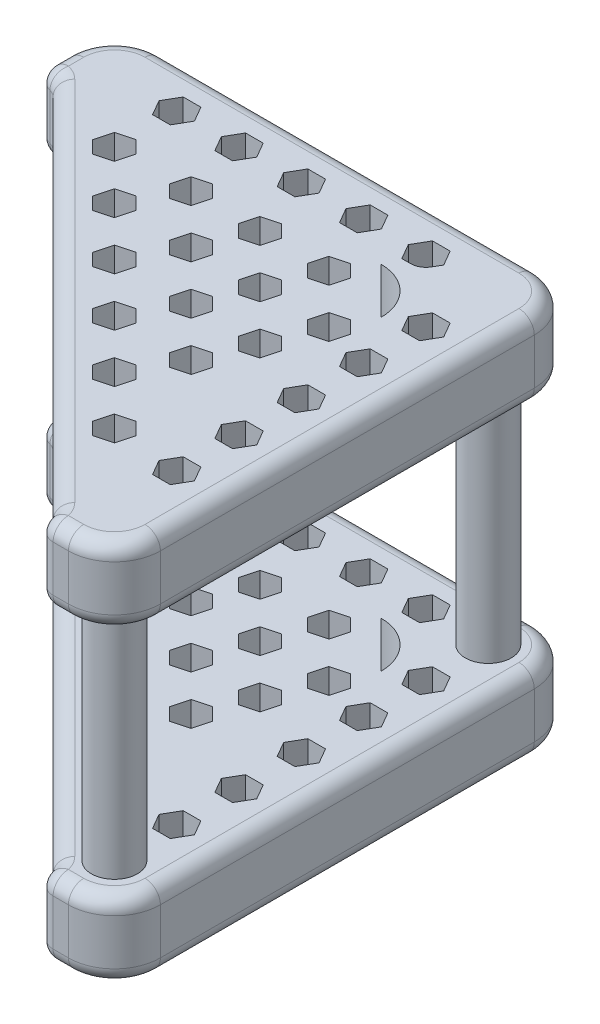
from build123d import *

# Parameters (mm, degrees)
SKETCH1_R           = 1.5
BOSS_EXTRUDE1_DEPTH = 5
SKETCH1_2_R         = 1.5
BOSS_EXTRUDE2_DEPTH = 25
BOSS_EXTRUDE3_START = -5
SKETCH2_R           = 1.5
BOSS_EXTRUDE3_DEPTH = 5
FILLET1_R           = 1


with BuildPart() as part:
    # Sketch1 → Boss-Extrude1 (new body)
    with BuildSketch(Plane(origin=(0, 0, 0), x_dir=(1, 0, 0), z_dir=(0, 1, 0))):
        with BuildLine():
            Line((-9.7, 17.7), (14.7, 17.7))
            ThreePointArc((14.7, 17.7), (16.821320344, 16.821320344), (17.7, 14.7))
            Line((17.7, 14.7), (17.7, -9.7))
            ThreePointArc((17.7, -9.7), (16.821320344, -11.821320344), (14.7, -12.7))
            Line((14.7, -12.7), (13.7, -12.7))
            ThreePointArc((13.7, -12.7), (13.08159356, -12.485858432), (12.72804017, -11.935146951))
            ThreePointArc((12.72804017, -11.935146951), (12.628148394, -11.68090928), (12.463187121, -11.463187121))
            Line((12.463187121, -11.463187121), (-11.463187121, 12.463187121))
            ThreePointArc((-11.463187121, 12.463187121), (-11.68090928, 12.628148394), (-11.935146951, 12.72804017))
            ThreePointArc((-11.935146951, 12.72804017), (-12.485858432, 13.08159356), (-12.7, 13.7))
            Line((-12.7, 13.7), (-12.7, 14.7))
            ThreePointArc((-12.7, 14.7), (-11.821320344, 16.821320344), (-9.7, 17.7))
        make_face()
        with Locations((-9.7, 14.7)):
            Circle(SKETCH1_R, mode=Mode.SUBTRACT)
        with Locations((14.7, -9.7)):
            Circle(SKETCH1_R, mode=Mode.SUBTRACT)
        with Locations((14.7, 14.7)):
            Circle(SKETCH1_R, mode=Mode.SUBTRACT)
        Polygon((-4.478632795, 14.7), (-5.055983064, 15.7), (-6.210683603, 15.7), (-6.788033872, 14.7), (-6.210683603, 13.7), (-5.055983064, 13.7), align=None, mode=Mode.SUBTRACT)
        Polygon((-0.411966128, 14.7), (-0.989316397, 15.7), (-2.144016936, 15.7), (-2.721367205, 14.7), (-2.144016936, 13.7), (-0.989316397, 13.7), align=None, mode=Mode.SUBTRACT)
        Polygon((3.654700538, 14.7), (3.077350269, 15.7), (1.922649731, 15.7), (1.345299462, 14.7), (1.922649731, 13.7), (3.077350269, 13.7), align=None, mode=Mode.SUBTRACT)
        Polygon((7.721367205, 14.7), (7.144016936, 15.7), (5.989316397, 15.7), (5.411966128, 14.7), (5.989316397, 13.7), (7.144016936, 13.7), align=None, mode=Mode.SUBTRACT)
        Polygon((11.788033872, 14.7), (11.210683603, 15.7), (10.055983064, 15.7), (9.478632795, 14.7), (10.055983064, 13.7), (11.210683603, 13.7), align=None, mode=Mode.SUBTRACT)
        Polygon((15.854700538, 10.633333333), (15.277350269, 11.633333333), (14.122649731, 11.633333333), (13.545299462, 10.633333333), (14.122649731, 9.633333333), (15.277350269, 9.633333333), align=None, mode=Mode.SUBTRACT)
        Polygon((15.854700538, 6.566666667), (15.277350269, 7.566666667), (14.122649731, 7.566666667), (13.545299462, 6.566666667), (14.122649731, 5.566666667), (15.277350269, 5.566666667), align=None, mode=Mode.SUBTRACT)
        Polygon((15.854700538, 2.5), (15.277350269, 3.5), (14.122649731, 3.5), (13.545299462, 2.5), (14.122649731, 1.5), (15.277350269, 1.5), align=None, mode=Mode.SUBTRACT)
        Polygon((15.854700538, -1.566666667), (15.277350269, -0.566666667), (14.122649731, -0.566666667), (13.545299462, -1.566666667), (14.122649731, -2.566666667), (15.277350269, -2.566666667), align=None, mode=Mode.SUBTRACT)
        Polygon((15.854700538, -5.633333333), (15.277350269, -4.633333333), (14.122649731, -4.633333333), (13.545299462, -5.633333333), (14.122649731, -6.633333333), (15.277350269, -6.633333333), align=None, mode=Mode.SUBTRACT)
        with BuildLine():
            Line((9.7, 12.7), (12.7, 9.7))
            ThreePointArc((12.7, 9.7), (11.821320344, 11.821320344), (9.7, 12.7))
        make_face(mode=Mode.SUBTRACT)
        Polygon((-1.634856237, 6.634856237), (-1.335997746, 7.750211309), (-2.152494327, 8.56670789), (-3.267849399, 8.267849399), (-3.56670789, 7.152494327), (-2.750211309, 6.335997746), align=None, mode=Mode.SUBTRACT)
        Polygon((-4.816836752, 9.816836752), (-4.517978262, 10.932191824), (-5.334474843, 11.748688405), (-6.449829914, 11.449829914), (-6.748688405, 10.334474843), (-5.932191824, 9.517978262), align=None, mode=Mode.SUBTRACT)
        Polygon((1.547124278, 3.452875722), (1.845982769, 4.568230793), (1.029486188, 5.384727374), (-0.085868884, 5.085868884), (-0.384727374, 3.970513812), (0.431769207, 3.154017231), align=None, mode=Mode.SUBTRACT)
        Polygon((4.729104794, 0.270895206), (5.027963284, 1.386250278), (4.211466703, 2.202746859), (3.096111632, 1.903888368), (2.797253141, 0.788533297), (3.613749722, -0.027963284), align=None, mode=Mode.SUBTRACT)
        Polygon((7.911085309, -2.911085309), (8.2099438, -1.795730237), (7.393447219, -0.979233656), (6.278092147, -1.278092147), (5.979233656, -2.393447219), (6.795730237, -3.2099438), align=None, mode=Mode.SUBTRACT)
        Polygon((11.093065824, -6.093065824), (11.391924315, -4.977710753), (10.575427734, -4.161214172), (9.460072662, -4.460072662), (9.161214172, -5.575427734), (9.977710753, -6.391924315), align=None, mode=Mode.SUBTRACT)
        Polygon((0.183163248, 9.816836752), (0.482021738, 10.932191824), (-0.334474843, 11.748688405), (-1.449829914, 11.449829914), (-1.748688405, 10.334474843), (-0.932191824, 9.517978262), align=None, mode=Mode.SUBTRACT)
        Polygon((3.365143763, 6.634856237), (3.664002254, 7.750211309), (2.847505673, 8.56670789), (1.732150601, 8.267849399), (1.43329211, 7.152494327), (2.249788691, 6.335997746), align=None, mode=Mode.SUBTRACT)
        Polygon((6.547124278, 3.452875722), (6.845982769, 4.568230793), (6.029486188, 5.384727374), (4.914131116, 5.085868884), (4.615272626, 3.970513812), (5.431769207, 3.154017231), align=None, mode=Mode.SUBTRACT)
        Polygon((9.729104794, 0.270895206), (10.027963284, 1.386250278), (9.211466703, 2.202746859), (8.096111632, 1.903888368), (7.797253141, 0.788533297), (8.613749722, -0.027963284), align=None, mode=Mode.SUBTRACT)
        Polygon((4.683163248, 9.816836752), (4.982021738, 10.932191824), (4.165525157, 11.748688405), (3.050170086, 11.449829914), (2.751311595, 10.334474843), (3.567808176, 9.517978262), align=None, mode=Mode.SUBTRACT)
        Polygon((7.865143763, 6.634856237), (8.164002254, 7.750211309), (7.347505673, 8.56670789), (6.232150601, 8.267849399), (5.93329211, 7.152494327), (6.749788691, 6.335997746), align=None, mode=Mode.SUBTRACT)
        Polygon((11.047124278, 3.452875722), (11.345982769, 4.568230793), (10.529486188, 5.384727374), (9.414131116, 5.085868884), (9.115272626, 3.970513812), (9.931769207, 3.154017231), align=None, mode=Mode.SUBTRACT)
        Polygon((9.183163248, 9.816836752), (9.482021738, 10.932191824), (8.665525157, 11.748688405), (7.550170086, 11.449829914), (7.251311595, 10.334474843), (8.067808176, 9.517978262), align=None, mode=Mode.SUBTRACT)
        Polygon((12.365143763, 6.634856237), (12.664002254, 7.750211309), (11.847505673, 8.56670789), (10.732150601, 8.267849399), (10.43329211, 7.152494327), (11.249788691, 6.335997746), align=None, mode=Mode.SUBTRACT)
    extrude(amount=BOSS_EXTRUDE1_DEPTH)

    # Sketch1<2> → Boss-Extrude2 (add)
    with BuildSketch(Plane(origin=(0, 0, 0), x_dir=(1, 0, 0), z_dir=(0, 1, 0))):
        with Locations((-9.7, 14.7)):
            Circle(SKETCH1_2_R)
        with Locations((14.7, -9.7)):
            Circle(SKETCH1_2_R)
        with Locations((14.7, 14.7)):
            Circle(SKETCH1_2_R)
    extrude(amount=BOSS_EXTRUDE2_DEPTH)

    # Sketch2 → Boss-Extrude3 (add)
    with BuildSketch(Plane(origin=(0, 25, 0), x_dir=(1, 0, 0), z_dir=(0, 1, 0)).offset(BOSS_EXTRUDE3_START)):
        with BuildLine():
            Line((-9.7, 17.7), (14.7, 17.7))
            ThreePointArc((14.7, 17.7), (16.821320344, 16.821320344), (17.7, 14.7))
            Line((17.7, 14.7), (17.7, -9.7))
            ThreePointArc((17.7, -9.7), (16.821320344, -11.821320344), (14.7, -12.7))
            Line((14.7, -12.7), (13.7, -12.7))
            ThreePointArc((13.7, -12.7), (13.08159356, -12.485858432), (12.72804017, -11.935146951))
            ThreePointArc((12.72804017, -11.935146951), (12.628148394, -11.68090928), (12.463187121, -11.463187121))
            Line((12.463187121, -11.463187121), (-11.463187121, 12.463187121))
            ThreePointArc((-11.463187121, 12.463187121), (-11.68090928, 12.628148394), (-11.935146951, 12.72804017))
            ThreePointArc((-11.935146951, 12.72804017), (-12.485858432, 13.08159356), (-12.7, 13.7))
            Line((-12.7, 13.7), (-12.7, 14.7))
            ThreePointArc((-12.7, 14.7), (-11.821320344, 16.821320344), (-9.7, 17.7))
        make_face()
        with Locations((-9.7, 14.7)):
            Circle(SKETCH2_R, mode=Mode.SUBTRACT)
        with Locations((14.7, -9.7)):
            Circle(SKETCH2_R, mode=Mode.SUBTRACT)
        with Locations((14.7, 14.7)):
            Circle(SKETCH2_R, mode=Mode.SUBTRACT)
        Polygon((-4.478632795, 14.7), (-5.055983064, 15.7), (-6.210683603, 15.7), (-6.788033872, 14.7), (-6.210683603, 13.7), (-5.055983064, 13.7), align=None, mode=Mode.SUBTRACT)
        Polygon((-0.411966128, 14.7), (-0.989316397, 15.7), (-2.144016936, 15.7), (-2.721367205, 14.7), (-2.144016936, 13.7), (-0.989316397, 13.7), align=None, mode=Mode.SUBTRACT)
        Polygon((3.654700538, 14.7), (3.077350269, 15.7), (1.922649731, 15.7), (1.345299462, 14.7), (1.922649731, 13.7), (3.077350269, 13.7), align=None, mode=Mode.SUBTRACT)
        Polygon((7.721367205, 14.7), (7.144016936, 15.7), (5.989316397, 15.7), (5.411966128, 14.7), (5.989316397, 13.7), (7.144016936, 13.7), align=None, mode=Mode.SUBTRACT)
        Polygon((11.788033872, 14.7), (11.210683603, 15.7), (10.055983064, 15.7), (9.478632795, 14.7), (10.055983064, 13.7), (11.210683603, 13.7), align=None, mode=Mode.SUBTRACT)
        Polygon((15.854700538, 10.633333333), (15.277350269, 11.633333333), (14.122649731, 11.633333333), (13.545299462, 10.633333333), (14.122649731, 9.633333333), (15.277350269, 9.633333333), align=None, mode=Mode.SUBTRACT)
        Polygon((15.854700538, 6.566666667), (15.277350269, 7.566666667), (14.122649731, 7.566666667), (13.545299462, 6.566666667), (14.122649731, 5.566666667), (15.277350269, 5.566666667), align=None, mode=Mode.SUBTRACT)
        Polygon((15.854700538, 2.5), (15.277350269, 3.5), (14.122649731, 3.5), (13.545299462, 2.5), (14.122649731, 1.5), (15.277350269, 1.5), align=None, mode=Mode.SUBTRACT)
        Polygon((15.854700538, -1.566666667), (15.277350269, -0.566666667), (14.122649731, -0.566666667), (13.545299462, -1.566666667), (14.122649731, -2.566666667), (15.277350269, -2.566666667), align=None, mode=Mode.SUBTRACT)
        Polygon((15.854700538, -5.633333333), (15.277350269, -4.633333333), (14.122649731, -4.633333333), (13.545299462, -5.633333333), (14.122649731, -6.633333333), (15.277350269, -6.633333333), align=None, mode=Mode.SUBTRACT)
        with BuildLine():
            Line((9.7, 12.7), (12.7, 9.7))
            ThreePointArc((12.7, 9.7), (11.821320344, 11.821320344), (9.7, 12.7))
        make_face(mode=Mode.SUBTRACT)
        Polygon((-1.634856237, 6.634856237), (-1.335997746, 7.750211309), (-2.152494327, 8.56670789), (-3.267849399, 8.267849399), (-3.56670789, 7.152494327), (-2.750211309, 6.335997746), align=None, mode=Mode.SUBTRACT)
        Polygon((-4.816836752, 9.816836752), (-4.517978262, 10.932191824), (-5.334474843, 11.748688405), (-6.449829914, 11.449829914), (-6.748688405, 10.334474843), (-5.932191824, 9.517978262), align=None, mode=Mode.SUBTRACT)
        Polygon((1.547124278, 3.452875722), (1.845982769, 4.568230793), (1.029486188, 5.384727374), (-0.085868884, 5.085868884), (-0.384727374, 3.970513812), (0.431769207, 3.154017231), align=None, mode=Mode.SUBTRACT)
        Polygon((4.729104794, 0.270895206), (5.027963284, 1.386250278), (4.211466703, 2.202746859), (3.096111632, 1.903888368), (2.797253141, 0.788533297), (3.613749722, -0.027963284), align=None, mode=Mode.SUBTRACT)
        Polygon((7.911085309, -2.911085309), (8.2099438, -1.795730237), (7.393447219, -0.979233656), (6.278092147, -1.278092147), (5.979233656, -2.393447219), (6.795730237, -3.2099438), align=None, mode=Mode.SUBTRACT)
        Polygon((11.093065824, -6.093065824), (11.391924315, -4.977710753), (10.575427734, -4.161214172), (9.460072662, -4.460072662), (9.161214172, -5.575427734), (9.977710753, -6.391924315), align=None, mode=Mode.SUBTRACT)
        Polygon((0.183163248, 9.816836752), (0.482021738, 10.932191824), (-0.334474843, 11.748688405), (-1.449829914, 11.449829914), (-1.748688405, 10.334474843), (-0.932191824, 9.517978262), align=None, mode=Mode.SUBTRACT)
        Polygon((3.365143763, 6.634856237), (3.664002254, 7.750211309), (2.847505673, 8.56670789), (1.732150601, 8.267849399), (1.43329211, 7.152494327), (2.249788691, 6.335997746), align=None, mode=Mode.SUBTRACT)
        Polygon((6.547124278, 3.452875722), (6.845982769, 4.568230793), (6.029486188, 5.384727374), (4.914131116, 5.085868884), (4.615272626, 3.970513812), (5.431769207, 3.154017231), align=None, mode=Mode.SUBTRACT)
        Polygon((9.729104794, 0.270895206), (10.027963284, 1.386250278), (9.211466703, 2.202746859), (8.096111632, 1.903888368), (7.797253141, 0.788533297), (8.613749722, -0.027963284), align=None, mode=Mode.SUBTRACT)
        Polygon((4.683163248, 9.816836752), (4.982021738, 10.932191824), (4.165525157, 11.748688405), (3.050170086, 11.449829914), (2.751311595, 10.334474843), (3.567808176, 9.517978262), align=None, mode=Mode.SUBTRACT)
        Polygon((7.865143763, 6.634856237), (8.164002254, 7.750211309), (7.347505673, 8.56670789), (6.232150601, 8.267849399), (5.93329211, 7.152494327), (6.749788691, 6.335997746), align=None, mode=Mode.SUBTRACT)
        Polygon((11.047124278, 3.452875722), (11.345982769, 4.568230793), (10.529486188, 5.384727374), (9.414131116, 5.085868884), (9.115272626, 3.970513812), (9.931769207, 3.154017231), align=None, mode=Mode.SUBTRACT)
        Polygon((9.183163248, 9.816836752), (9.482021738, 10.932191824), (8.665525157, 11.748688405), (7.550170086, 11.449829914), (7.251311595, 10.334474843), (8.067808176, 9.517978262), align=None, mode=Mode.SUBTRACT)
        Polygon((12.365143763, 6.634856237), (12.664002254, 7.750211309), (11.847505673, 8.56670789), (10.732150601, 8.267849399), (10.43329211, 7.152494327), (11.249788691, 6.335997746), align=None, mode=Mode.SUBTRACT)
    extrude(amount=BOSS_EXTRUDE3_DEPTH)

    # Fillet1
    fillet1_edges = [part.edges().sort_by_distance(p)[0] for p in [
        (-11.68090928, 20, -12.628148394),
        (-12.485858432, 20, -13.08159356),
        (-12.7, 20, -14.2),
        (-11.821320344, 20, -16.821320344),
        (2.5, 20, -17.7),
        (16.821320344, 20, -16.821320344),
        (17.7, 20, -2.5),
        (16.821320344, 20, 11.821320344),
        (14.2, 20, 12.7),
        (13.08159356, 20, 12.485858432),
        (12.628148394, 20, 11.68090928),
        (-11.68090928, 5, -12.628148394),
        (-12.485858432, 5, -13.08159356),
        (-12.7, 5, -14.2),
        (-11.821320344, 5, -16.821320344),
        (2.5, 5, -17.7),
        (16.821320344, 5, -16.821320344),
        (17.7, 5, -2.5),
        (16.821320344, 5, 11.821320344),
        (14.2, 5, 12.7),
        (13.08159356, 5, 12.485858432),
        (12.628148394, 5, 11.68090928),
        (-11.68090928, 0, -12.628148394),
        (-12.485858432, 0, -13.08159356),
        (-12.7, 0, -14.2),
        (-11.821320344, 0, -16.821320344),
        (2.5, 0, -17.7),
        (16.821320344, 0, -16.821320344),
        (17.7, 0, -2.5),
        (16.821320344, 0, 11.821320344),
        (14.2, 0, 12.7),
        (13.08159356, 0, 12.485858432),
        (12.628148394, 0, 11.68090928),
        (-11.68090928, 25, -12.628148394),
        (-12.485858432, 25, -13.08159356),
        (-12.7, 25, -14.2),
        (-11.821320344, 25, -16.821320344),
        (2.5, 25, -17.7),
        (16.821320344, 25, -16.821320344),
        (17.7, 25, -2.5),
        (16.821320344, 25, 11.821320344),
        (14.2, 25, 12.7),
        (13.08159356, 25, 12.485858432),
        (12.628148394, 25, 11.68090928),
        (0.5, 20, -0.5),
        (0.5, 5, -0.5),
        (0.5, 0, -0.5),
        (11.210683603, 22.5, -13.7),
        (0.5, 25, -0.5),
    ]]
    fillet(fillet1_edges, radius=FILLET1_R)


solid = part.part
